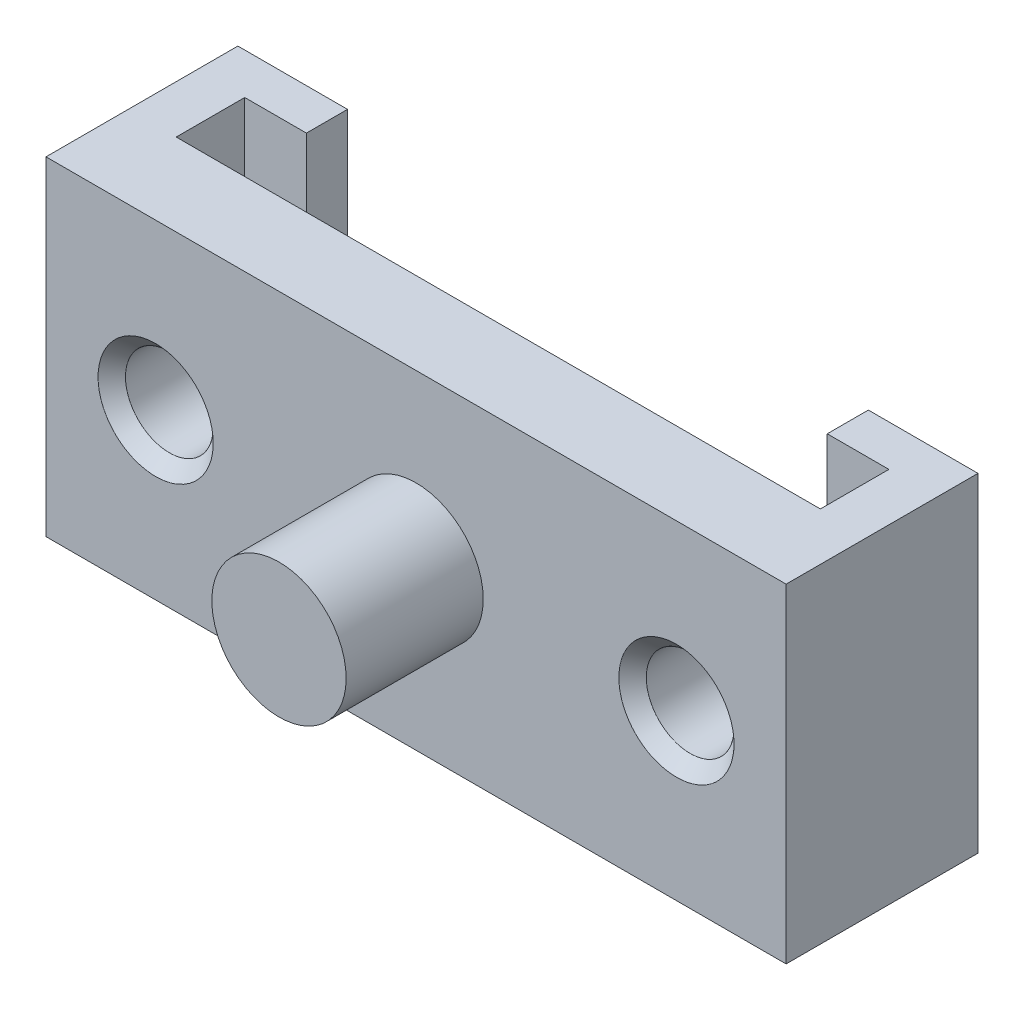
from build123d import *

# Parameters (mm, degrees)
SKETCH1_W           = 27
SKETCH1_H           = 12
BOSS_EXTRUDE1_DEPTH = 3
SKETCH2_R           = 2.45
BOSS_EXTRUDE2_DEPTH = 5
SKETCH3_W           = 1.75
SKETCH3_H           = 12
BOSS_EXTRUDE3_DEPTH = 2.5
SKETCH4_R           = 1.6
CUT_EXTRUDE1_DEPTH  = 31.61045573
SKETCH5_W           = 4
SKETCH5_H           = 12
BOSS_EXTRUDE4_DEPTH = 1.5
FILLET1_SIZE        = 0.5


with BuildPart() as part:
    # Sketch1 → Boss-Extrude1 (new body)
    with BuildSketch(Plane.XY):
        with Locations((13.5, -6)):
            Rectangle(SKETCH1_W, SKETCH1_H)
    extrude(amount=BOSS_EXTRUDE1_DEPTH)

    # Sketch2 → Boss-Extrude2 (add)
    with BuildSketch(Plane.XY.offset(3)):
        with Locations((13.5, -6)):
            Circle(SKETCH2_R)
    extrude(amount=BOSS_EXTRUDE2_DEPTH)

    # Sketch3 → Boss-Extrude3 (add)
    with BuildSketch(Plane(origin=(0, 0, 0), x_dir=(-1, 0, 0), z_dir=(0, 0, -1))):
        with Locations((-0.875, -6)):
            Rectangle(SKETCH3_W, SKETCH3_H)
        with Locations((-26.125, -6)):
            Rectangle(SKETCH3_W, SKETCH3_H)
    extrude(amount=BOSS_EXTRUDE3_DEPTH)

    # Sketch4 → Cut-Extrude1 (cut, through all)
    with BuildSketch(Plane(origin=(0, 0, 0), x_dir=(-1, 0, 0), z_dir=(0, 0, -1))):
        with Locations((-4, -6)):
            Circle(SKETCH4_R)
        with Locations((-23, -6)):
            Circle(SKETCH4_R)
    extrude(amount=-CUT_EXTRUDE1_DEPTH, mode=Mode.SUBTRACT)

    # Sketch5 → Boss-Extrude4 (add)
    with BuildSketch(Plane(origin=(0, 0, -2.5), x_dir=(-1, 0, 0), z_dir=(0, 0, -1))):
        with Locations((-2, -6)):
            Rectangle(SKETCH5_W, SKETCH5_H)
        with Locations((-25, -6)):
            Rectangle(SKETCH5_W, SKETCH5_H)
    extrude(amount=BOSS_EXTRUDE4_DEPTH)

    # Fillet1
    # a fillet whose section is not a circle: 0.5 mm, written as the material it takes off along each edge
    with BuildSketch(Plane(origin=(4, -6, 3), x_dir=(-1, 0, 0), z_dir=(0, -1, 0))) as fillet1_piece_1:
        with BuildLine():
            Bezier((1.6, FILLET1_SIZE), (1.6, 0), (1.6 + FILLET1_SIZE, 0), weights=[1, 3.5355e-05, 1])
            Line((1.6 + FILLET1_SIZE, 0), (1.6, 0))
            Line((1.6, 0), (1.6, FILLET1_SIZE))
        make_face()
    revolve(axis=Axis((4, -6, 3), (0, 0, -1)), mode=Mode.SUBTRACT)
    with BuildSketch(Plane(origin=(23, -6, 3), x_dir=(-1, 0, 0), z_dir=(0, -1, 0))) as fillet1_piece_2:
        with BuildLine():
            Bezier((1.6, FILLET1_SIZE), (1.6, 0), (1.6 + FILLET1_SIZE, 0), weights=[1, 3.5355e-05, 1])
            Line((1.6 + FILLET1_SIZE, 0), (1.6, 0))
            Line((1.6, 0), (1.6, FILLET1_SIZE))
        make_face()
    revolve(axis=Axis((23, -6, 3), (0, 0, -1)), mode=Mode.SUBTRACT)


solid = part.part
